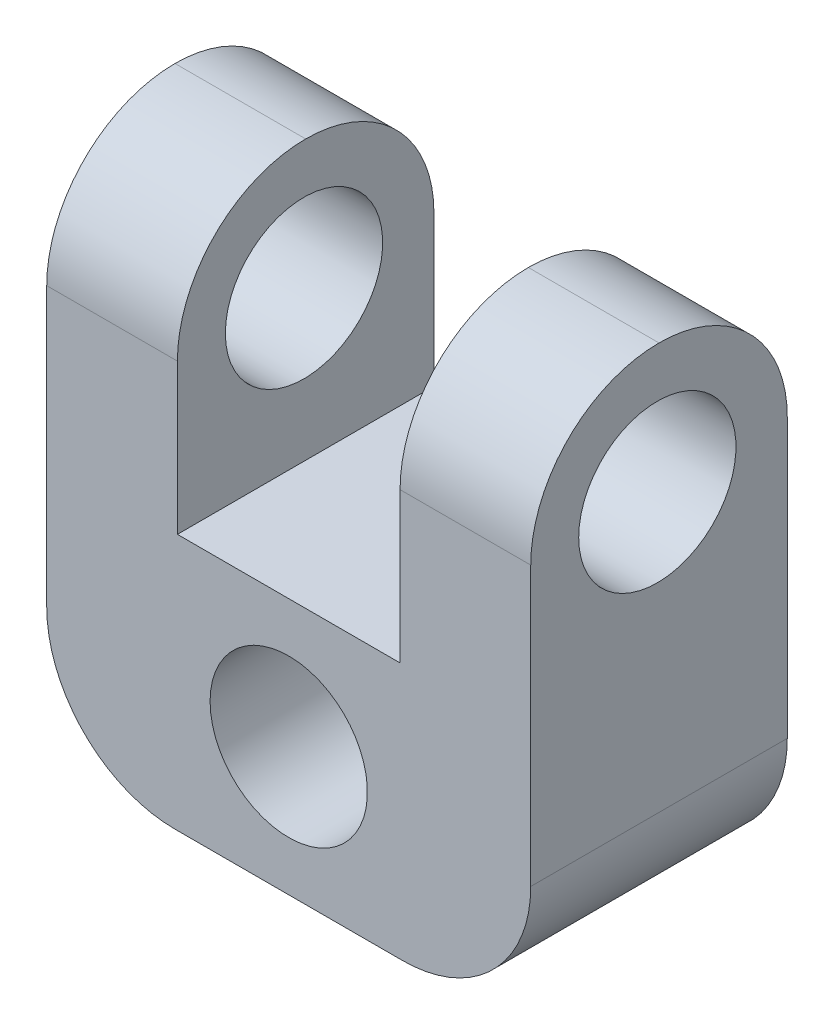
from build123d import *

# Parameters (mm, degrees)
SCHIZZO1_W                   = 10
SCHIZZO1_H                   = 5.3
ESTRUSIONE_ESTRUSIONE1_DEPTH = 5.3
SCHIZZO2_R                   = 1.625
TAGLIO_ESTRUSIONE3_DEPTH     = 8.753225135
SCHIZZO3_W                   = 2.7
SCHIZZO3_H                   = 5.3
ESTRUSIONE_ESTRUSIONE2_DEPTH = 5.75
SCHIZZO4_R                   = 1.625
TAGLIO_ESTRUSIONE4_DEPTH     = 15.094325099
RACCORDO2_R                  = 2.65
RACCORDO3_R                  = 2.65


with BuildPart() as part:
    # Schizzo1 → Estrusione-Estrusione1 (new body)
    with BuildSketch(Plane.XY):
        Rectangle(SCHIZZO1_W, SCHIZZO1_H)
    extrude(amount=ESTRUSIONE_ESTRUSIONE1_DEPTH)

    # Schizzo2 → Taglio-Estrusione3 (cut, through all)
    with BuildSketch(Plane(origin=(0, 0, 0), x_dir=(-1, 0, 0), z_dir=(0, 0, -1))):
        Circle(SCHIZZO2_R)
    extrude(amount=-TAGLIO_ESTRUSIONE3_DEPTH, mode=Mode.SUBTRACT)

    # Schizzo3 → Estrusione-Estrusione2 (add)
    with BuildSketch(Plane(origin=(0, 2.65, 0), x_dir=(1, 0, 0), z_dir=(0, 1, 0))):
        with Locations((3.65, -2.65)):
            Rectangle(SCHIZZO3_W, SCHIZZO3_H)
        with Locations((-3.65, -2.65)):
            Rectangle(SCHIZZO3_W, SCHIZZO3_H)
    extrude(amount=ESTRUSIONE_ESTRUSIONE2_DEPTH)

    # Schizzo4 → Taglio-Estrusione4 (cut, through all)
    with BuildSketch(Plane.ZY.offset(5)):
        with Locations((2.684358211, 5.75)):
            Circle(SCHIZZO4_R)
    extrude(amount=-TAGLIO_ESTRUSIONE4_DEPTH, mode=Mode.SUBTRACT)

    # Raccordo2
    raccordo2_edges = [part.edges().sort_by_distance(p)[0] for p in [
        (3.65, 8.4, 0),
        (3.65, 8.4, 5.3),
        (-3.65, 8.4, 5.3),
        (-3.65, 8.4, 0),
    ]]
    fillet(raccordo2_edges, radius=RACCORDO2_R - 0.0001)  # a hair under: the kernel refuses the full size

    # Raccordo3
    raccordo3_edges = [part.edges().sort_by_distance(p)[0] for p in [
        (-5, -2.65, 2.65),
        (5, -2.65, 2.65),
    ]]
    fillet(raccordo3_edges, radius=RACCORDO3_R)


solid = part.part
